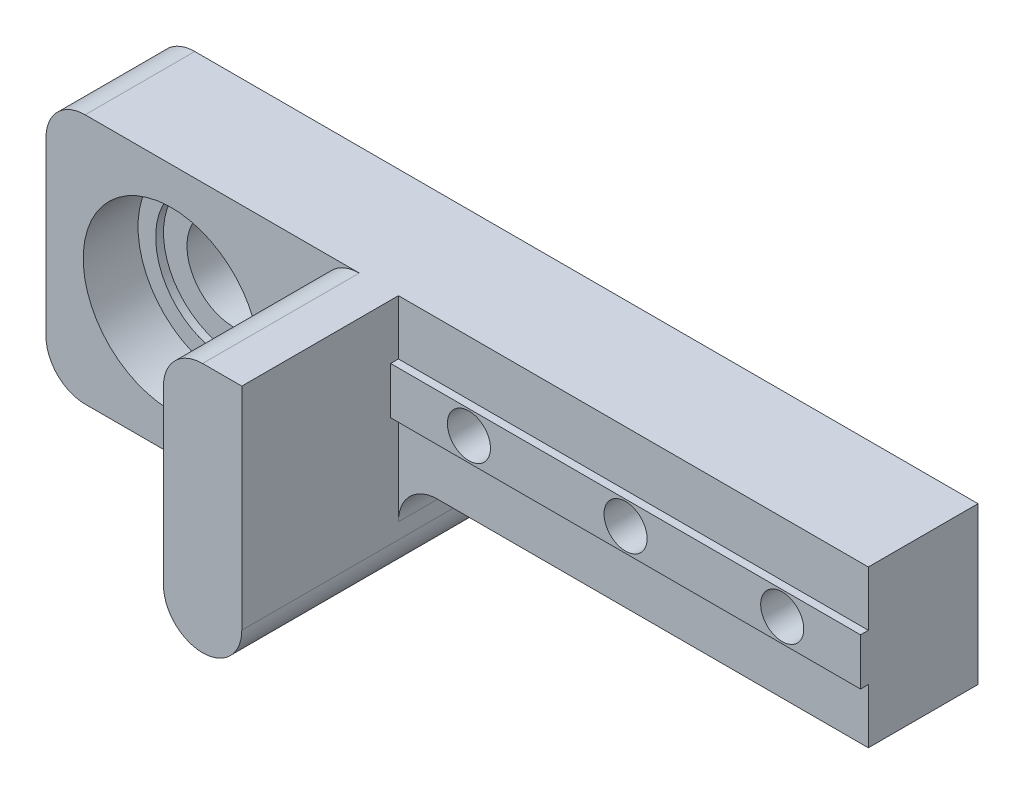
from build123d import *

# Parameters (mm, degrees)
SALIENTE_EXTRUIR1_DEPTH = 14
CROQUIS3_R              = 11.25
CORTAR_EXTRUIR1_DEPTH   = 7
CROQUIS4_R              = 9
CORTAR_EXTRUIR2_DEPTH   = 1
CORTAR_EXTRUIR3_REACH   = 112.059
CROQUIS5_R              = 6
CROQUIS8_W              = 10
CROQUIS8_H              = 32
SALIENTE_EXTRUIR4_DEPTH = 20
REDONDEO1_R             = 5
CROQUIS10_W             = 60
CROQUIS10_H             = 6
SALIENTE_EXTRUIR7_DEPTH = 1
CROQUIS6_R              = 2.75
CORTAR_EXTRUIR6_DEPTH   = 40
CROQUIS11_R             = 6
CORTAR_EXTRUIR7_DEPTH   = 8


with BuildPart() as part:
    # Croquis2 → Saliente-Extruir1 (new body)
    with BuildSketch(Plane.XY):
        Polygon((0, 0), (-105, 0), (-105, -32), (-60, -32), (-60, -20), (0, -20), align=None)
    extrude(amount=SALIENTE_EXTRUIR1_DEPTH)

    # Croquis3 → Cortar-Extruir1 (cut)
    with BuildSketch(Plane.XY.offset(14)):
        with Locations((-89, -16)):
            Circle(CROQUIS3_R)
    extrude(amount=-CORTAR_EXTRUIR1_DEPTH, mode=Mode.SUBTRACT)

    # Croquis4 → Cortar-Extruir2 (cut)
    with BuildSketch(Plane.XY.offset(7)):
        with Locations((-89, -16)):
            Circle(CROQUIS4_R)
    extrude(amount=-CORTAR_EXTRUIR2_DEPTH, mode=Mode.SUBTRACT)

    # Croquis5 → Cortar-Extruir3 (cut, up to next)
    with BuildSketch(Plane.XY.offset(6), mode=Mode.PRIVATE) as cortar_extruir3_sk1:
        with Locations((-89, -16)):
            Circle(CROQUIS5_R)
    cortar_extruir3_tool1 = extrude(cortar_extruir3_sk1.sketch, amount=-CORTAR_EXTRUIR3_REACH, mode=Mode.PRIVATE) & part.part
    add(cortar_extruir3_tool1.solids().sort_by_distance((-89, -16, 6))[0], mode=Mode.SUBTRACT)

    # Croquis8 → Saliente-Extruir4 (add)
    with BuildSketch(Plane.XY.offset(14)):
        with Locations((-65, -16)):
            Rectangle(CROQUIS8_W, CROQUIS8_H)
    extrude(amount=SALIENTE_EXTRUIR4_DEPTH)

    # Redondeo1
    redondeo1_edges = [part.edges().sort_by_distance(p)[0] for p in [
        (-70, 0, 24),
        (-70, -32, 24),
        (-60, -20, 7),
        (-105, -32, 7),
        (-105, 0, 7),
        (-60, -32, 17),
    ]]
    fillet(redondeo1_edges, radius=REDONDEO1_R - 0.0001)  # a hair under: the kernel refuses the full size

    # Croquis10 → Saliente-Extruir7 (add)
    with BuildSketch(Plane.XY.offset(14)):
        with Locations((-30, -10)):
            Rectangle(CROQUIS10_W, CROQUIS10_H)
    extrude(amount=SALIENTE_EXTRUIR7_DEPTH)

    # Croquis6 → Cortar-Extruir6 (cut)
    with BuildSketch(Plane(origin=(0, 0, 0), x_dir=(-1, 0, 0), z_dir=(0, 0, -1))):
        with Locations((10, -10)):
            Circle(CROQUIS6_R)
        with Locations((30, -10)):
            Circle(CROQUIS6_R)
        with Locations((50, -10)):
            Circle(CROQUIS6_R)
    extrude(amount=-CORTAR_EXTRUIR6_DEPTH, mode=Mode.SUBTRACT)

    # Croquis11 → Cortar-Extruir7 (cut)
    with BuildSketch(Plane(origin=(0, 0, 0), x_dir=(-1, 0, 0), z_dir=(0, 0, -1))):
        with Locations((10, -10)):
            Circle(CROQUIS11_R)
        with Locations((30, -10)):
            Circle(CROQUIS11_R)
        with Locations((50, -10)):
            Circle(CROQUIS11_R)
    extrude(amount=-CORTAR_EXTRUIR7_DEPTH, mode=Mode.SUBTRACT)


solid = part.part
